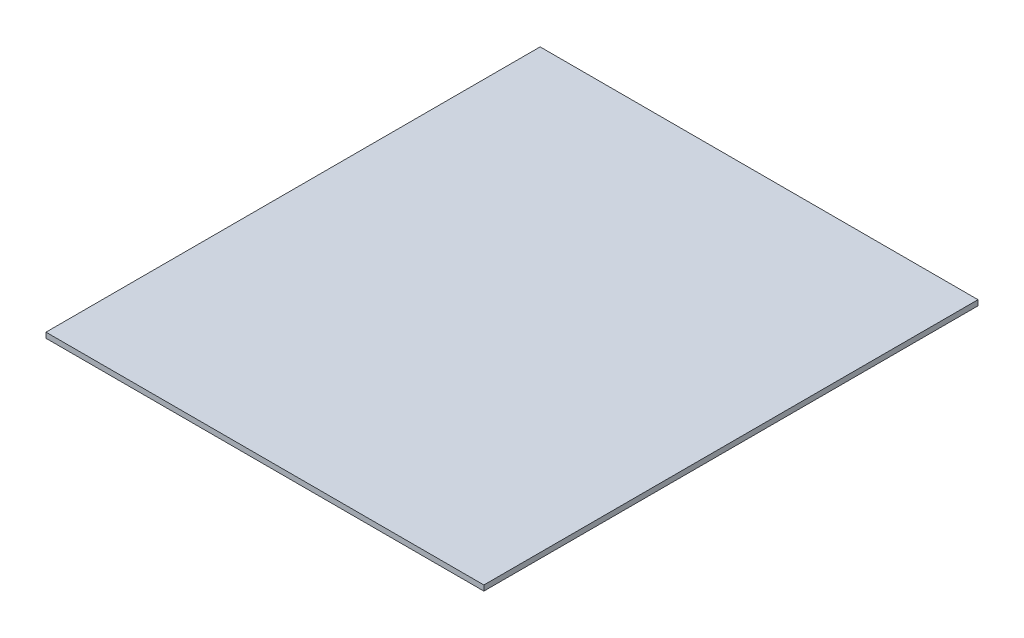
from build123d import *

# Parameters (mm, degrees)
SKETCH1_W           = 519.1125
SKETCH1_H           = 585.7875
BOSS_EXTRUDE1_DEPTH = 6.35


with BuildPart() as part:
    # Sketch1 → Boss-Extrude1 (new body)
    with BuildSketch(Plane(origin=(0, 0, 0), x_dir=(1, 0, 0), z_dir=(0, 1, 0))):
        Rectangle(SKETCH1_W, SKETCH1_H)
    extrude(amount=BOSS_EXTRUDE1_DEPTH)


solid = part.part
